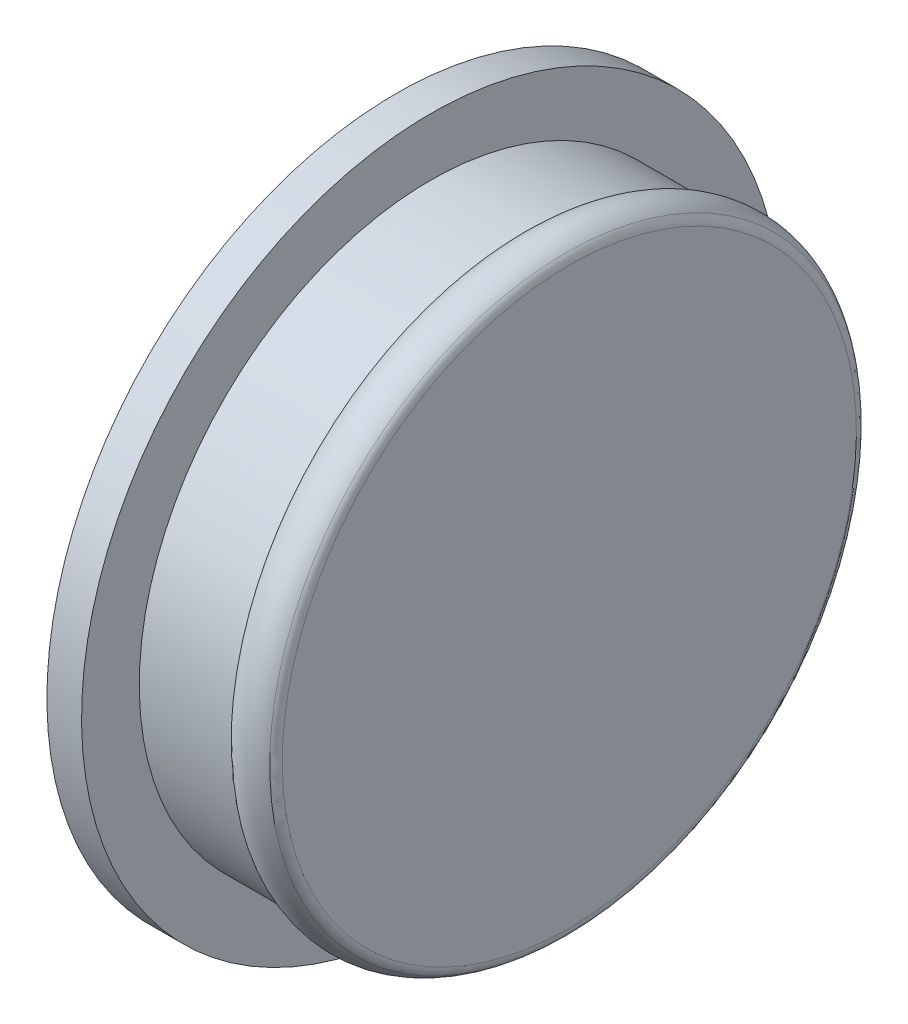
from build123d import *

# Parameters (mm, degrees)
CHAMFER1_SIZE  = 1.27
CHAMFER1_SIZE2 = 1.513527063
FILLET1_R      = 0.254
CHAMFER3_SIZE  = 1.27
FILLET2_R      = 0.254


# Some blends are built 0.0001 mm under size
with BuildPart() as part:
    # Sketch1 → Revolve1 (revolve)
    with BuildSketch(Plane.XY, mode=Mode.PRIVATE) as revolve1_sk:
        with BuildLine():
            Line((-0.508, 7.6835), (-0.508, 6.4135))
            Line((-0.508, 6.4135), (1.524, 6.4135))
            ThreePointArc((1.524, 6.4135), (2.032, 6.6675), (2.54, 6.4135))
            Line((2.54, 6.4135), (2.54, 0))
            Line((2.54, 0), (1.27, 0))
            Line((1.27, 0), (1.27, 5.1435))
            Line((1.27, 5.1435), (-1.27, 5.1435))
            Line((-1.27, 5.1435), (-1.27, 7.6835))
            Line((-1.27, 7.6835), (-0.508, 7.6835))
        make_face()
    revolve(revolve1_sk.sketch.rotate(Axis((-6.503305215, 0, 0), (1, 0, 0)), 180), axis=Axis((-6.503305215, 0, 0), (1, 0, 0)))

    # Chamfer1
    chamfer1_edges = [part.edges().sort_by_distance(p)[0] for p in [
        (1.27, 5.1435, 0),
    ]]
    chamfer1_side = [part.faces().sort_by_distance(p)[0] for p in [
        (0, 5.1435, 0),
    ]]
    chamfer(chamfer1_edges, length=CHAMFER1_SIZE, length2=CHAMFER1_SIZE2, reference=chamfer1_side[0])

    # Fillet1
    fillet1_edges = [part.edges().sort_by_distance(p)[0] for p in [
        (2.54, 6.4135, 0),
    ]]
    fillet(fillet1_edges, radius=FILLET1_R)

    # Chamfer3
    chamfer3_edges = [part.edges().sort_by_distance(p)[0] for p in [
        (-1.27, 5.1435, 0),
    ]]
    chamfer(chamfer3_edges, length=CHAMFER3_SIZE - 0.0001)  # a hair under: the kernel refuses the full size

    # Fillet2
    # the kernel refuses this fillet: 0.254 mm, written as the material it adds along each edge
    with BuildSketch(Plane(origin=(0, 0, 0), x_dir=(0, -1, 0), z_dir=(0, 0, 1))) as fillet2_piece_1:
        with BuildLine():
            CenterArc((4.975502814, -0.190607075), FILLET2_R, 48.592790784, 1.407209216)
            Line((5.138770867, 0.003968214), (5.1435, 0))
            Line((5.1435, 0), (5.1435, -0.0001))
        make_face()
    revolve(axis=Axis((0, 0, 0), (1, 0, 0)))


solid = part.part
